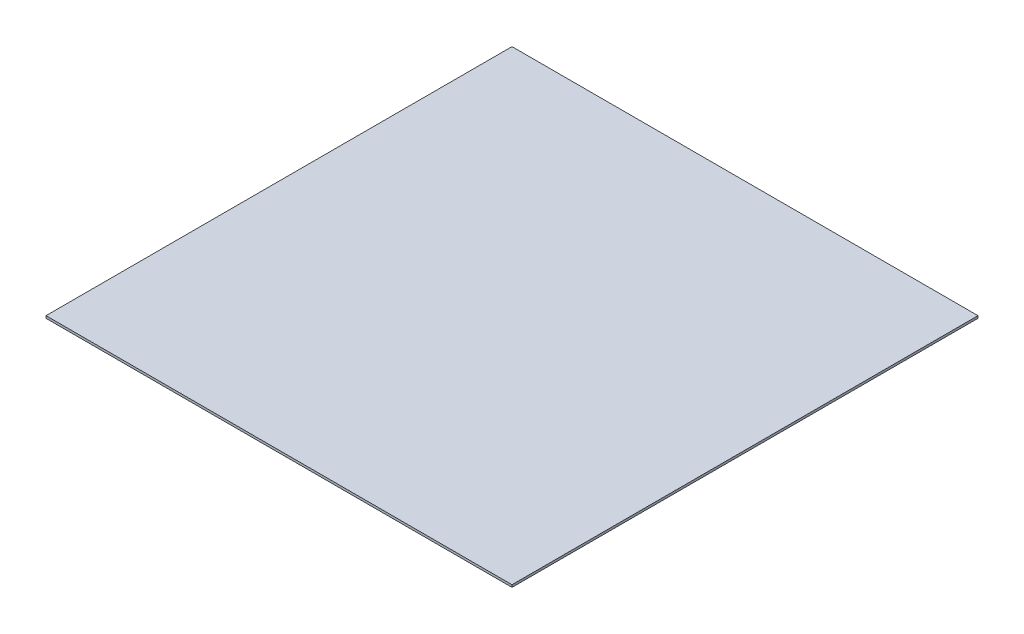
from build123d import *

# Parameters (mm, degrees)
ESBO_O1_W                = 1000
ESBO_O1_H                = 1000
RESSALTO_EXTRUS_O1_DEPTH = 5


with BuildPart() as part:
    # Esboço1 → Ressalto-extrusão1 (new body)
    with BuildSketch(Plane(origin=(0, 0, 0), x_dir=(1, 0, 0), z_dir=(0, 1, 0))):
        with Locations((500, 500)):
            Rectangle(ESBO_O1_W, ESBO_O1_H)
    extrude(amount=RESSALTO_EXTRUS_O1_DEPTH)


solid = part.part
